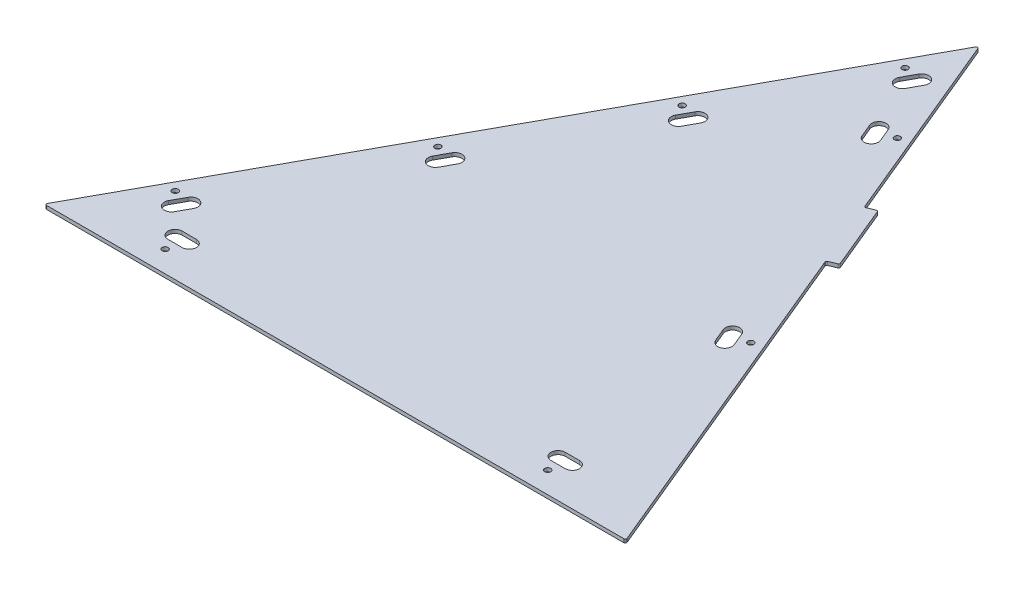
from build123d import *

# Parameters (mm, degrees)
SKETCH4_R           = 5.3578125
BOSS_EXTRUDE2_DEPTH = 6.35
CUT_EXTRUDE1_DEPTH  = 1277.826258948
FILLET1_R           = 2.54


with BuildPart() as part:
    # Sketch4 → Boss-Extrude2 (new body)
    with BuildSketch(Plane(origin=(0, 0, 0), x_dir=(1, 0, 0), z_dir=(0, 1, 0))):
        Polygon((234.979236566, 1078.971634327), (-356.170330123, 0), (682.689669877, 0), (429.674039163, 609.761730508), (447.269410556, 617.062785606), (398.595709907, 734.36526156), (381.000338514, 727.064206463), align=None)
        with Locations((-178.370330123, 38.1)):
            Circle(SKETCH4_R, mode=Mode.SUBTRACT)
        with Locations((-259.300975608, 137.16)):
            Circle(SKETCH4_R, mode=Mode.SUBTRACT)
        with Locations((-93.289784566, 440.165155055)):
            Circle(SKETCH4_R, mode=Mode.SUBTRACT)
        with Locations((504.889669877, 38.1)):
            Circle(SKETCH4_R, mode=Mode.SUBTRACT)
        with Locations((489.29326545, 416.375307605)):
            Circle(SKETCH4_R, mode=Mode.SUBTRACT)
        with Locations((61.094542054, 721.948850069)):
            Circle(SKETCH4_R, mode=Mode.SUBTRACT)
        with Locations((303.667495105, 863.729056592)):
            Circle(SKETCH4_R, mode=Mode.SUBTRACT)
        with Locations((201.97392089, 979.083189991)):
            Circle(SKETCH4_R, mode=Mode.SUBTRACT)
    extrude(amount=BOSS_EXTRUDE2_DEPTH)

    # Sketch5 → Cut-Extrude1 (cut, through all)
    with BuildSketch(Plane(origin=(0, 6.35, 0), x_dir=(1, 0, 0), z_dir=(0, 1, 0))):
        with BuildLine():
            Line((-250.361653335, 116.472417753), (-238.157149202, 138.748191115))
            ThreePointArc((-238.157149202, 138.748191115), (-220.917010455, 143.783825729), (-215.88137584, 126.543686982))
            Line((-215.88137584, 126.543686982), (-228.085879973, 104.26791362))
            ThreePointArc((-228.085879973, 104.26791362), (-245.326018721, 99.232279006), (-250.361653335, 116.472417753))
        make_face()
        with BuildLine():
            Line((-191.070330123, 81.28), (-165.670330123, 81.28))
            ThreePointArc((-165.670330123, 81.28), (-152.970330123, 68.58), (-165.670330123, 55.88))
            Line((-165.670330123, 55.88), (-191.070330123, 55.88))
            ThreePointArc((-191.070330123, 55.88), (-203.770330123, 68.58), (-191.070330123, 81.28))
        make_face()
        with BuildLine():
            Line((-83.493702347, 421.041338954), (-71.289198214, 443.317112316))
            ThreePointArc((-71.289198214, 443.317112316), (-54.049059466, 448.35274693), (-49.013424852, 431.112608183))
            Line((-49.013424852, 431.112608183), (-61.217928985, 408.836834821))
            ThreePointArc((-61.217928985, 408.836834821), (-78.458067732, 403.801200206), (-83.493702347, 421.041338954))
        make_face()
        with BuildLine():
            Line((211.607161604, 959.662154075), (223.811665737, 981.937927436))
            ThreePointArc((223.811665737, 981.937927436), (241.051804485, 986.973562051), (246.087439099, 969.733423303))
            Line((246.087439099, 969.733423303), (233.882934966, 947.457649942))
            ThreePointArc((233.882934966, 947.457649942), (216.642796219, 942.422015327), (211.607161604, 959.662154075))
        make_face()
        with BuildLine():
            Line((70.0689996, 701.325397046), (82.328936684, 723.702347141))
            ThreePointArc((82.328936684, 723.702347141), (99.569075432, 728.737981755), (104.604710046, 711.497843008))
            Line((104.604710046, 711.497843008), (92.344772962, 689.120892913))
            ThreePointArc((92.344772962, 689.120892913), (75.104634214, 684.085258298), (70.0689996, 701.325397046))
        make_face()
        with BuildLine():
            Line((467.764558528, 421.867197937), (477.499298658, 398.406702746))
            ThreePointArc((477.499298658, 398.406702746), (470.636421128, 381.809085085), (454.038803467, 388.671962616))
            Line((454.038803467, 388.671962616), (444.304063337, 412.132457807))
            ThreePointArc((444.304063337, 412.132457807), (451.166940868, 428.730075467), (467.764558528, 421.867197937))
        make_face()
        with BuildLine():
            Line((492.961263737, 81.28), (518.361263737, 81.28))
            ThreePointArc((518.361263737, 81.28), (531.061263737, 68.58), (518.361263737, 55.88))
            Line((518.361263737, 55.88), (492.961263737, 55.88))
            ThreePointArc((492.961263737, 55.88), (480.261263737, 68.58), (492.961263737, 81.28))
        make_face()
        with BuildLine():
            Line((282.363160209, 868.680215609), (292.097900339, 845.219720419))
            ThreePointArc((292.097900339, 845.219720419), (285.235022808, 828.622102758), (268.637405148, 835.484980289))
            Line((268.637405148, 835.484980289), (258.902665018, 858.94547548))
            ThreePointArc((258.902665018, 858.94547548), (265.765542549, 875.54309314), (282.363160209, 868.680215609))
        make_face()
    extrude(amount=-CUT_EXTRUDE1_DEPTH, mode=Mode.SUBTRACT)

    # Fillet1
    fillet1_edges = [part.edges().sort_by_distance(p)[0] for p in [
        (398.595709907, 3.175, -734.36526156),
        (447.269410556, 3.175, -617.062785606),
        (429.674039163, 3.175, -609.761730508),
        (381.000338514, 3.175, -727.064206463),
        (682.689669877, 3.175, 0),
        (-356.170330123, 3.175, 0),
        (234.979236566, 3.175, -1078.971634327),
    ]]
    fillet(fillet1_edges, radius=FILLET1_R)


solid = part.part
